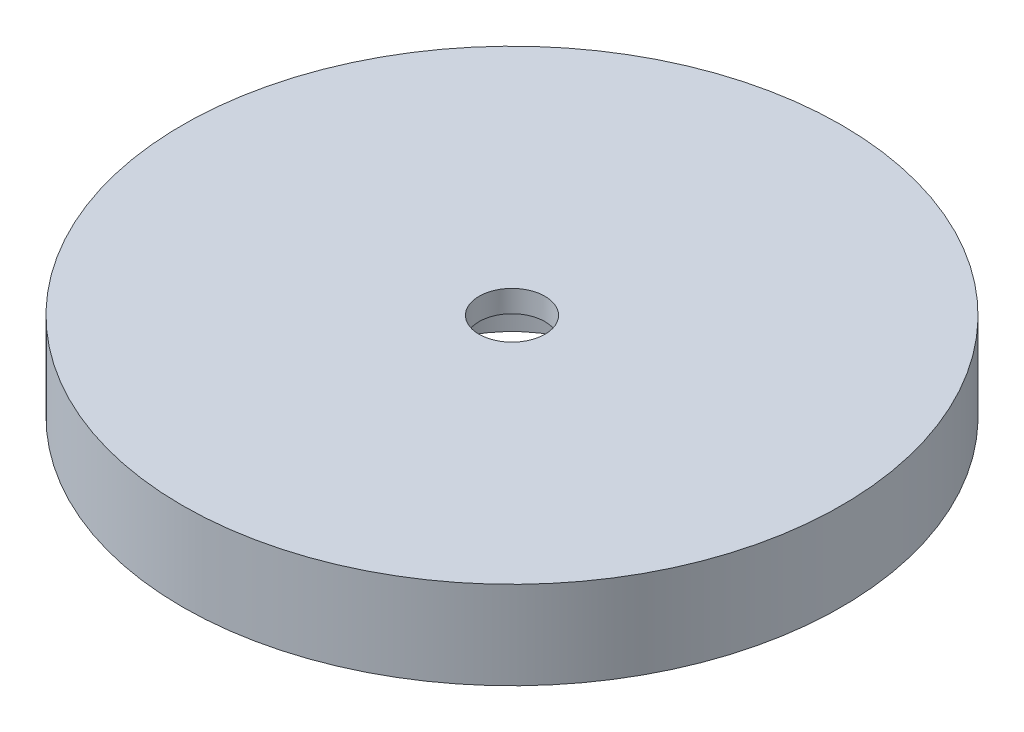
from build123d import *

# Parameters (mm, degrees)
ESQUISSE1_R             = 30
BOSS_EXTRU_1_DEPTH      = 8
ESQUISSE2_R             = 9.5
ENL_V_MAT_EXTRU_1_DEPTH = 6
ESQUISSE3_R             = 3
ENL_V_MAT_EXTRU_2_DEPTH = 44.17406629


with BuildPart() as part:
    # Esquisse1 → Boss.-Extru.1 (new body)
    with BuildSketch(Plane(origin=(0, 0, 0), x_dir=(1, 0, 0), z_dir=(0, 1, 0))):
        Circle(ESQUISSE1_R)
    extrude(amount=BOSS_EXTRU_1_DEPTH)

    # Esquisse2 → Enlèv. mat.-Extru.1 (cut)
    with BuildSketch(Plane.XZ):
        Circle(ESQUISSE2_R)
    extrude(amount=-ENL_V_MAT_EXTRU_1_DEPTH, mode=Mode.SUBTRACT)

    # Esquisse3 → Enlèv. mat.-Extru.2 (cut, through all)
    with BuildSketch(Plane(origin=(0, 8, 0), x_dir=(1, 0, 0), z_dir=(0, 1, 0))):
        Circle(ESQUISSE3_R)
    extrude(amount=-ENL_V_MAT_EXTRU_2_DEPTH, mode=Mode.SUBTRACT)


solid = part.part
